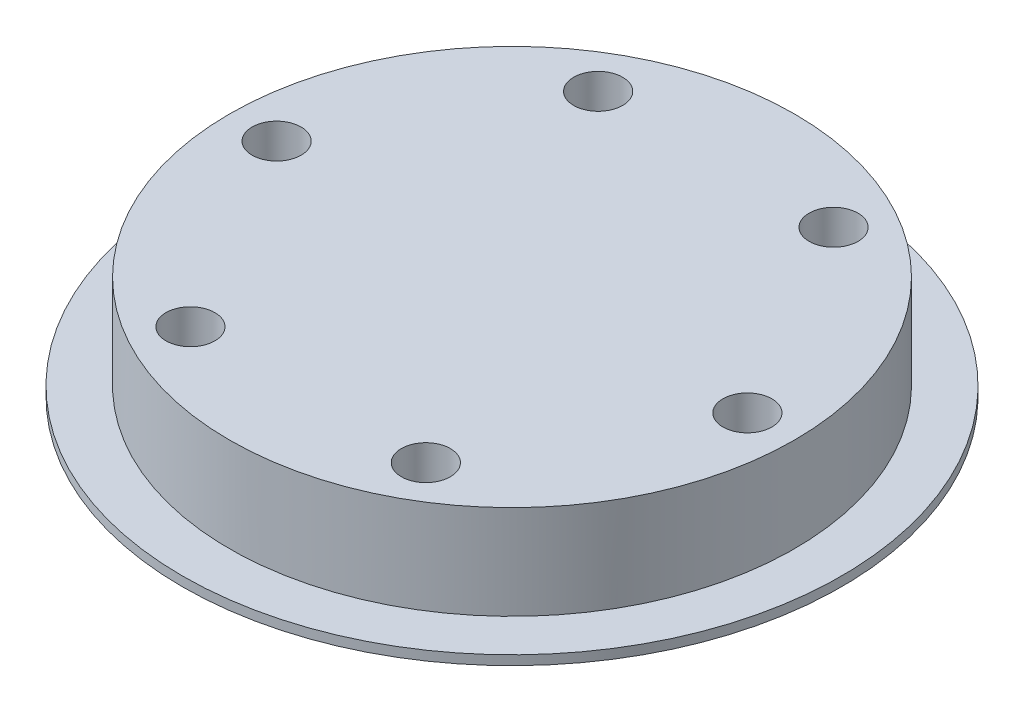
from build123d import *

# Parameters (mm, degrees)
SKETCH1_R           = 30
BOSS_EXTRUDE1_DEPTH = 11
SKETCH2_R           = 35
BOSS_EXTRUDE2_DEPTH = 1
SKETCH3_R           = 1.5
CUT_EXTRUDE1_DEPTH  = 5
SKETCH4_R           = 14
CUT_EXTRUDE2_DEPTH  = 7
SKETCH5_R           = 2.6
CUT_EXTRUDE3_DEPTH  = 25


with BuildPart() as part:
    # Sketch1 → Boss-Extrude1 (new body)
    with BuildSketch(Plane(origin=(0, 0, 0), x_dir=(1, 0, 0), z_dir=(0, 1, 0))):
        Circle(SKETCH1_R)
    extrude(amount=BOSS_EXTRUDE1_DEPTH)

    # Sketch2 → Boss-Extrude2 (add)
    with BuildSketch(Plane.XZ):
        Circle(SKETCH2_R)
    extrude(amount=-BOSS_EXTRUDE2_DEPTH)

    # Sketch3 → Cut-Extrude1 (cut)
    with BuildSketch(Plane(origin=(0, 0, 0), x_dir=(1, 0, 0), z_dir=(0, 1, 0))):
        with Locations((0, 25)):
            Circle(SKETCH3_R)
        with Locations((21.650635095, 12.5)):
            Circle(SKETCH3_R)
        with Locations((21.650635095, -12.5)):
            Circle(SKETCH3_R)
        with Locations((0, -25)):
            Circle(SKETCH3_R)
        with Locations((-21.650635095, -12.5)):
            Circle(SKETCH3_R)
        with Locations((-21.650635095, 12.5)):
            Circle(SKETCH3_R)
    extrude(amount=CUT_EXTRUDE1_DEPTH, mode=Mode.SUBTRACT)

    # Sketch4 → Cut-Extrude2 (cut)
    with BuildSketch(Plane.XZ):
        Circle(SKETCH4_R)
    extrude(amount=-CUT_EXTRUDE2_DEPTH, mode=Mode.SUBTRACT)

    # Sketch5 → Cut-Extrude3 (cut)
    with BuildSketch(Plane.XZ):
        with Locations((-12.5, 21.650635095)):
            Circle(SKETCH5_R)
        with Locations((12.5, 21.650635095)):
            Circle(SKETCH5_R)
        with Locations((25, 0)):
            Circle(SKETCH5_R)
        with Locations((12.5, -21.650635095)):
            Circle(SKETCH5_R)
        with Locations((-12.5, -21.650635095)):
            Circle(SKETCH5_R)
        with Locations((-25, 0)):
            Circle(SKETCH5_R)
    extrude(amount=-CUT_EXTRUDE3_DEPTH, mode=Mode.SUBTRACT)


solid = part.part
